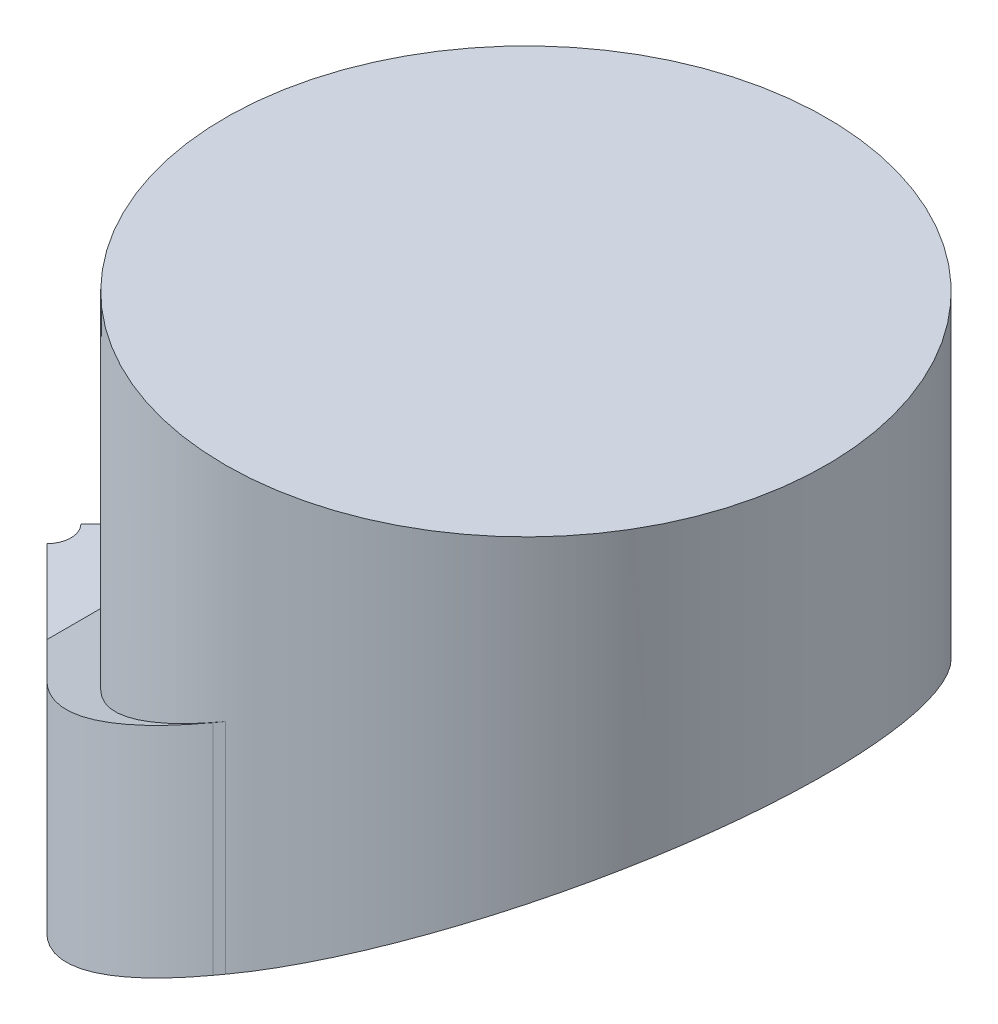
from build123d import *

# Parameters (mm, degrees)
BOSS_EXTRUDE1_DEPTH             = 138
SKETCH10_R                      = 150
BOSS_EXTRUDE6_DEPTH             = 220
BOSS_EXTRUDE6_DIRECTION_2_REACH = 314.006
SPLIT3_DEPTH                    = 76
FILLET2_R                       = 200
BOSS_EXTRUDE7_DEPTH             = 109.159437572


with BuildPart() as part:
    # Sketch1 → Boss-Extrude1 (new body)
    with BuildSketch(Plane(origin=(0, 0, 0), x_dir=(1, 0, 0), z_dir=(0, 1, 0))):
        with BuildLine():
            Line((8.485281374, 8.485281374), (150, 150))
            Line((150, 150), (278.911017507, 150))
            Line((278.911017507, 150), (278.911017507, -150))
            Line((278.911017507, -150), (150, -150))
            Line((150, -150), (8.485281374, -8.485281374))
            ThreePointArc((8.485281374, -8.485281374), (12, 0), (8.485281374, 8.485281374))
        make_face()
    extrude(amount=BOSS_EXTRUDE1_DEPTH)

    # Split1
    split(bisect_by=Plane(origin=(0, 0, 0), x_dir=(-0.8660254037844416, -0.49999999999999495, 0), z_dir=(0.49999999999999495, -0.8660254037844416, 0)), keep=Keep.BOTTOM)

    # Sketch10 → Boss-Extrude6 (add)
    with BuildSketch(Plane(origin=(0, 138, 0), x_dir=(1, 0, 0), z_dir=(0, 1, 0))):
        with Locations(Location((239.023011445, 0, 0), (0, 0, 270))):
            Circle(SKETCH10_R)
    extrude(amount=BOSS_EXTRUDE6_DEPTH)

    # Boss-Extrude6 direction 2: up to this face of the body (flat: up to its plane)
    boss_extrude6_direction_2_end = Plane(part.part.faces().sort_by_distance((151.627791868, 87.542346451, 0))[0])
    # Sketch10 → Boss-Extrude6 direction 2 (add, up to the picked face)
    with BuildSketch(Plane(origin=(0, 138, 0), x_dir=(1, 0, 0), z_dir=(0, 1, 0)), mode=Mode.PRIVATE) as boss_extrude6_direction_2_sk1:
        with Locations(Location((239.023011445, 0, 0), (0, 0, 270))):
            Circle(SKETCH10_R)
    boss_extrude6_direction_2_tool1 = split(extrude(boss_extrude6_direction_2_sk1.sketch, amount=-BOSS_EXTRUDE6_DIRECTION_2_REACH, mode=Mode.PRIVATE), bisect_by=boss_extrude6_direction_2_end, keep=Keep.BOTH, mode=Mode.PRIVATE)
    add(boss_extrude6_direction_2_tool1.solids().sort_by(Axis((239.023011, 138, 0), (0, -1, 0)))[0])

    # Split3: read off the stored shape, not the designer's step
    # Split3 outline → Split3 (cut)
    with BuildSketch(Plane(origin=(0, 0, 0), x_dir=(0.8660254037844416, 0.4999999999999948, 0), z_dir=(0.4999999999999948, -0.8660254037844417, 0))):
        with BuildLine():
            Line((173.205080757, -150), (276, -150))
            add(Edge.make_bspline(
                [(276, -150), (449.205080757, -150), (449.205080757, 0), (449.205080757, 150), (276, 150)],
                knots=[4.71238898, 4.71238898, 4.71238898, 6.283185307, 6.283185307, 7.853981634, 7.853981634, 7.853981634], degree=2, weights=[1, 0.707106781, 1, 0.707106781, 1]))
            Line((276, 150), (173.205080757, 150))
            Line((173.205080757, 150), (9.797958971, 8.485281374))
            add(Edge.make_bspline(
                [(9.797958971, -8.485281374), (19.595917942, 0), (9.797958971, 8.485281374)],
                knots=[2.35619449, 2.35619449, 2.35619449, 3.926990817, 3.926990817, 3.926990817], degree=2, weights=[1, 0.707106781, 1]))
            Line((9.797958971, -8.485281374), (173.205080757, -150))
        make_face()
    extrude(amount=SPLIT3_DEPTH, mode=Mode.SUBTRACT)

    # Fillet2
    fillet2_edges = [part.edges().sort_by_distance(p)[0] for p in [
        (150, 112.301270189, -150),
        (150, 112.301270189, 150),
    ]]
    fillet(fillet2_edges, radius=FILLET2_R)

    # Sketch12 → Boss-Extrude7 (add, along a direction that is not the sketch's normal)
    with BuildSketch(Plane(origin=(0, 0, 0), x_dir=(0.8660254037844417, 0.49999999999999495, 0), z_dir=(0.49999999999999495, -0.8660254037844417, 0))):
        with BuildLine():
            Line((9.797958971, -8.485281374), (105.564289267, -91.421356237))
            add(Edge.make_bspline(
                [(105.564289267, -91.421356237), (173.205080757, -150), (268.863605452, -150)],
                knots=[0.785398163, 0.785398163, 0.785398163, 1.570796327, 1.570796327, 1.570796327], degree=2, weights=[1, 0.923879533, 1]))
            Line((268.863605452, -150), (276, -150))
            add(Edge.make_bspline(
                [(276, -150), (449.205080757, -150), (449.205080757, 0), (449.205080757, 150), (276, 150)],
                knots=[4.71238898, 4.71238898, 4.71238898, 6.283185307, 6.283185307, 7.853981634, 7.853981634, 7.853981634], degree=2, weights=[1, 0.707106781, 1, 0.707106781, 1]))
            Line((276, 150), (268.863605452, 150))
            add(Edge.make_bspline(
                [(268.863605452, 150), (173.205080757, 150), (105.564289267, 91.421356237)],
                knots=[4.71238898, 4.71238898, 4.71238898, 5.497787144, 5.497787144, 5.497787144], degree=2, weights=[1, 0.923879533, 1]))
            Line((105.564289267, 91.421356237), (9.797958971, 8.485281374))
            add(Edge.make_bspline(
                [(9.797958971, -8.485281374), (19.595917942, 0), (9.797958971, 8.485281374)],
                knots=[2.35619449, 2.35619449, 2.35619449, 3.926990817, 3.926990817, 3.926990817], degree=2, weights=[1, 0.707106781, 1]))
        make_face()
    extrude(amount=-BOSS_EXTRUDE7_DEPTH, dir=(0, -1, 0))


solid = part.part
